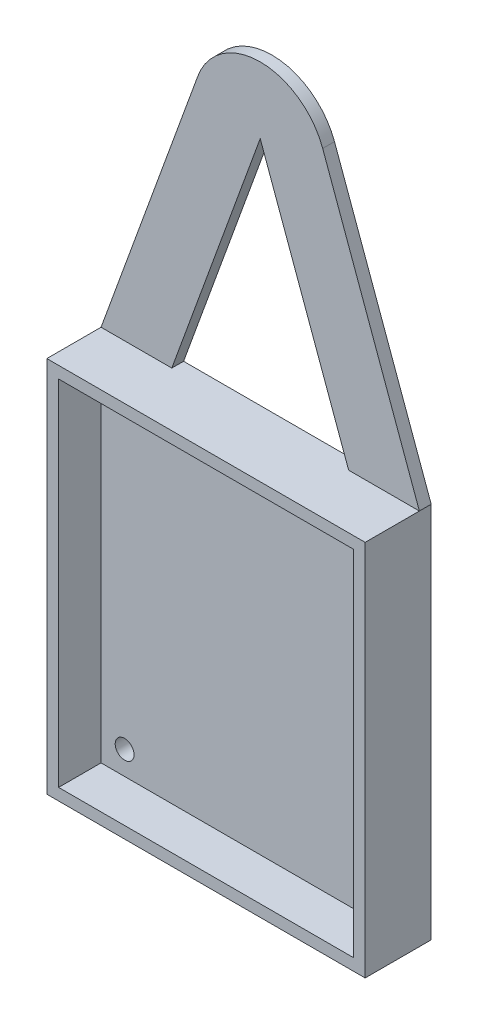
from build123d import *

# Parameters (mm, degrees)
BOSS_EXTRUDE1_DEPTH       = 5
SKETCH2_W                 = 135
SKETCH2_H                 = 160
BOSS_EXTRUDE2_DEPTH       = 5
CUT_EXTRUDE1_DEPTH        = 5
CUT_EXTRUDE1_DEPTH_BACK   = 1
SKETCH3_R                 = 4
SKETCH4_W                 = 135
SKETCH4_H                 = 160
SKETCH4_W_2               = 125
SKETCH4_H_2               = 150
BOSS_EXTRUDE3_DEPTH       = 18
SKETCH5_R                 = 4
CUT_EXTRUDE2_DEPTH        = 2
F_2_5MM_DOWEL_HOLE1_D     = 2.5
F_2_5MM_DOWEL_HOLE1_DEPTH = 12
F_2_5MM_DOWEL_HOLE1_TIP   = 0.751075774


with BuildPart() as part:
    # Sketch1 → Boss-Extrude1 (new body)
    with BuildSketch(Plane.XY):
        with BuildLine():
            Line((-67.5, 80), (-67.5, -80))
            Line((-67.5, -80), (67.5, -80))
            Line((67.5, -80), (67.5, 80))
            Line((67.5, 80), (26.490666647, 192.672217375))
            ThreePointArc((26.490666647, 192.672217375), (0, 211.221181853), (-26.490666647, 192.672217375))
            Line((-26.490666647, 192.672217375), (-67.5, 80))
        make_face()
        Polygon((-37.5, 80), (37.5, 80), (0, 183.03040323), align=None, mode=Mode.SUBTRACT)
    extrude(amount=BOSS_EXTRUDE1_DEPTH)

    # Sketch2 → Boss-Extrude2 (add)
    with BuildSketch(Plane.XY.offset(5)):
        Rectangle(SKETCH2_W, SKETCH2_H)
    extrude(amount=BOSS_EXTRUDE2_DEPTH)

    # Sketch3 → Cut-Extrude1 (cut, two sides: drawn at the far end of the back side and taken through both)
    with BuildSketch(Plane.XY.offset(5).offset(-CUT_EXTRUDE1_DEPTH_BACK)):
        with Locations((-52.5, 65)):
            Circle(SKETCH3_R)
        with Locations((52.5, 65)):
            Circle(SKETCH3_R)
        with Locations((52.5, -65)):
            Circle(SKETCH3_R)
        with Locations((-52.5, -65)):
            Circle(SKETCH3_R)
    extrude(amount=CUT_EXTRUDE1_DEPTH + CUT_EXTRUDE1_DEPTH_BACK, mode=Mode.SUBTRACT)

    # Sketch4 → Boss-Extrude3 (add)
    with BuildSketch(Plane.XY.offset(10)):
        Rectangle(SKETCH4_W, SKETCH4_H)
        Rectangle(SKETCH4_W_2, SKETCH4_H_2, mode=Mode.SUBTRACT)
    extrude(amount=BOSS_EXTRUDE3_DEPTH)

    # Sketch5 → Cut-Extrude2 (cut)
    with BuildSketch(Plane(origin=(0, 0, 0), x_dir=(-1, 0, 0), z_dir=(0, 0, -1))):
        with Locations((-52.5, 65)):
            Circle(SKETCH5_R)
        with Locations((52.5, 65)):
            Circle(SKETCH5_R)
        with Locations((52.5, -65)):
            Circle(SKETCH5_R)
        with Locations((-52.5, -65)):
            Circle(SKETCH5_R)
    extrude(amount=-CUT_EXTRUDE2_DEPTH, mode=Mode.SUBTRACT)

    # Ø2.5mm Dowel Hole1
    with Locations(Plane(origin=(0, 0, 2), x_dir=(-1, 0, 0), z_dir=(0, 0, -1))):
        with Locations((-52.5, 65), (52.5, 65), (52.5, -65), (-52.5, -65)):
            Hole(F_2_5MM_DOWEL_HOLE1_D / 2, depth=F_2_5MM_DOWEL_HOLE1_DEPTH)
            with Locations((0, 0, -(F_2_5MM_DOWEL_HOLE1_DEPTH + F_2_5MM_DOWEL_HOLE1_TIP / 2))):  # 118° drill point
                Cone(0, F_2_5MM_DOWEL_HOLE1_D / 2, F_2_5MM_DOWEL_HOLE1_TIP, mode=Mode.SUBTRACT)


solid = part.part
